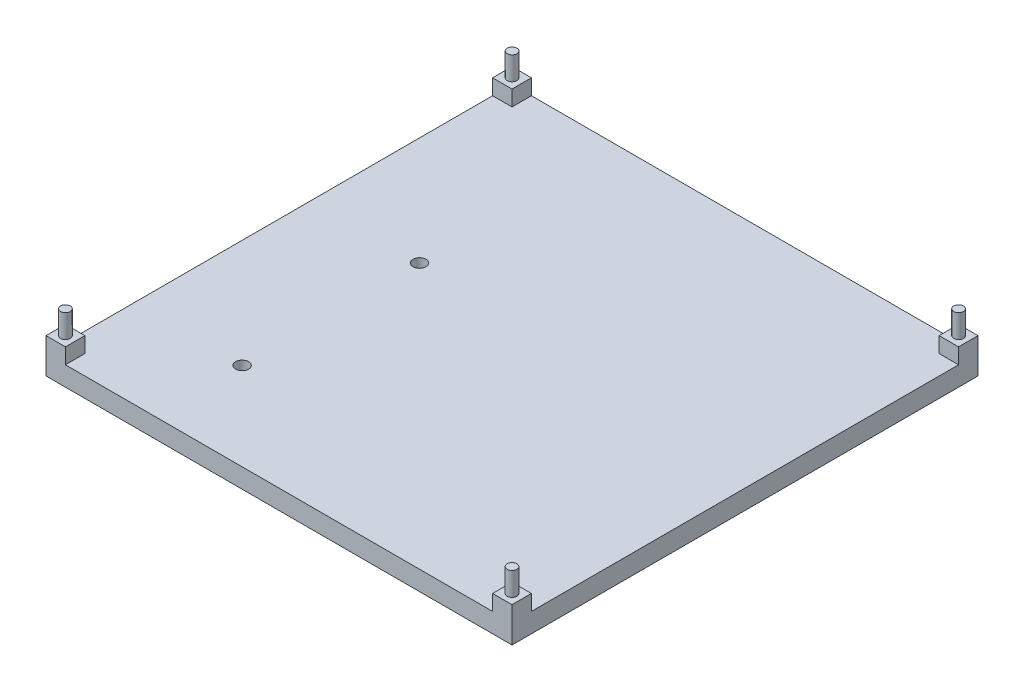
from build123d import *

# Parameters (mm, degrees)
STOCK_PLATE_BETA1_1_OUTLINE_W   = 152.4
STOCK_PLATE_BETA1_1_OUTLINE_H   = 152.4
STOCK_PLATE_BETA1_1_OUTLINE_R   = 2.125
STOCK_PLATE_BETA1_1_DEPTH       = 6.35
STOCK_PLATE_BETA1_1_START       = 6.35
STOCK_PLATE_BETA1_1_2_OUTLINE_W = 6.35
STOCK_PLATE_BETA1_1_2_OUTLINE_H = 6.35
STOCK_PLATE_BETA1_1_2_DEPTH     = 5.08
SKETCH1_R                       = 1.5875
BOSS_EXTRUDE1_DEPTH             = 7.62


# Read off the part's stored shape, not the designer's step: Stock-plate_beta1-1
with BuildPart() as part:
    # Stock-plate_beta1-1 outline → Stock-plate_beta1-1 (new body)
    with BuildSketch(Plane(origin=(0, 0, 0), x_dir=(1, 0, 0), z_dir=(0, 1, 0))):
        with Locations((40.776583963, 45.362139437)):
            Rectangle(STOCK_PLATE_BETA1_1_OUTLINE_W, STOCK_PLATE_BETA1_1_OUTLINE_H)
        with Locations((0, -2.125)):
            Circle(STOCK_PLATE_BETA1_1_OUTLINE_R, mode=Mode.SUBTRACT)
        with Locations((0, 55.889)):
            Circle(STOCK_PLATE_BETA1_1_OUTLINE_R, mode=Mode.SUBTRACT)
    extrude(amount=STOCK_PLATE_BETA1_1_DEPTH)

    # Stock-plate_beta1-1 2 outline → Stock-plate_beta1-1 2 (add)
    with BuildSketch(Plane(origin=(0, 0, 0), x_dir=(1, 0, 0), z_dir=(0, 1, 0)).offset(STOCK_PLATE_BETA1_1_START)):
        with Locations((113.801583963, 118.387139437)):
            Rectangle(STOCK_PLATE_BETA1_1_2_OUTLINE_W, STOCK_PLATE_BETA1_1_2_OUTLINE_H)
        with Locations((-32.248416037, 118.387139437)):
            Rectangle(STOCK_PLATE_BETA1_1_2_OUTLINE_W, STOCK_PLATE_BETA1_1_2_OUTLINE_H)
        with Locations((113.801583963, -27.662860563)):
            Rectangle(STOCK_PLATE_BETA1_1_2_OUTLINE_W, STOCK_PLATE_BETA1_1_2_OUTLINE_H)
        with Locations((-32.248416037, -27.662860563)):
            Rectangle(STOCK_PLATE_BETA1_1_2_OUTLINE_W, STOCK_PLATE_BETA1_1_2_OUTLINE_H)
    extrude(amount=STOCK_PLATE_BETA1_1_2_DEPTH)

    # Sketch1 → Boss-Extrude1 (add)
    with BuildSketch(Plane(origin=(0, 11.43, 0), x_dir=(1, 0, 0), z_dir=(0, 1, 0))):
        with Locations(Location((-32.248416037, -27.662860563, 0), (0, 0, 90))):
            Circle(SKETCH1_R)
        with Locations(Location((-32.225272977, 118.387139437, 0), (0, 0, 90))):
            Circle(SKETCH1_R)
        with Locations(Location((113.801583963, 118.387139437, 0), (0, 0, 90))):
            Circle(SKETCH1_R)
        with Locations(Location((113.801583963, -27.662860563, 0), (0, 0, 90))):
            Circle(SKETCH1_R)
    extrude(amount=BOSS_EXTRUDE1_DEPTH)


solid = part.part
